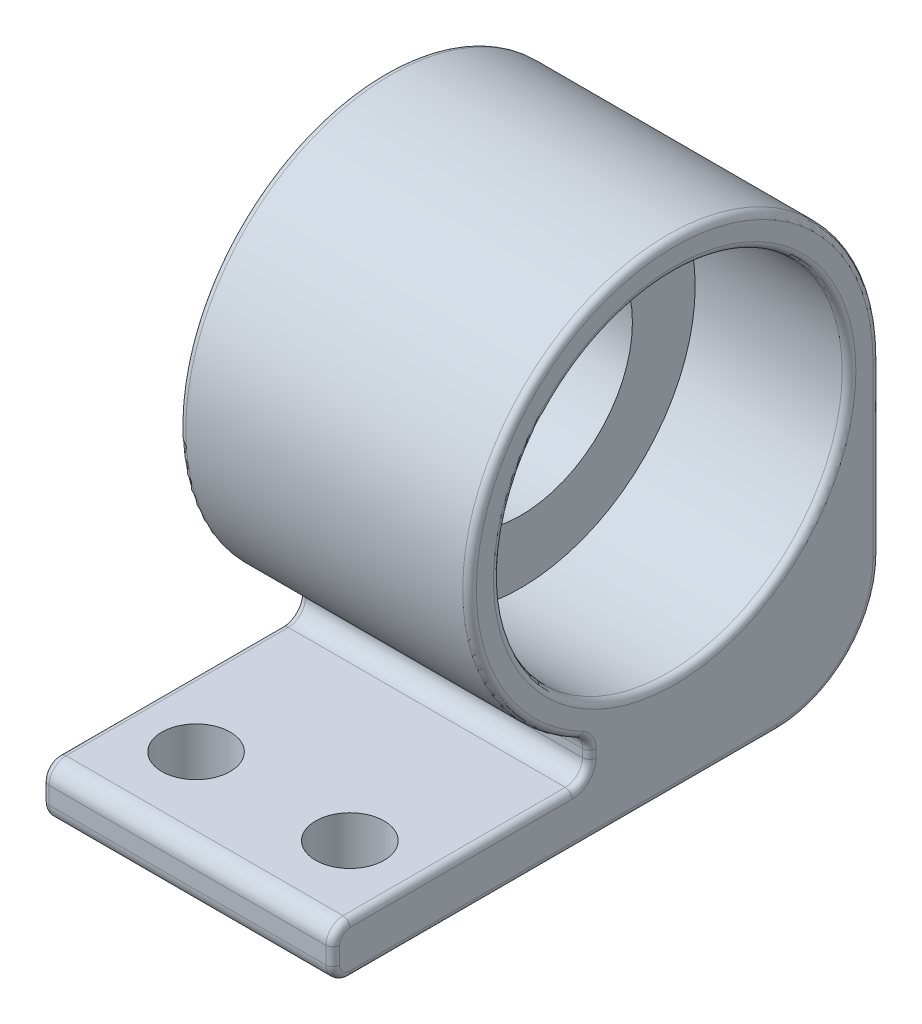
from build123d import *

# Parameters (mm, degrees)
EXTRUDE_1_DEPTH             = 8.5
SKETCH_2_R                  = 2
CUT_EXTRUDE_1_DEPTH         = 10
SKETCH_6_R                  = 5.1
CUT_EXTRUDE_3_DEPTH         = 4.5
HOLE_WIZARD_5_16_18_1_D     = 6.5278
HOLE_WIZARD_5_16_18_1_DEPTH = 3.2
HOLE_WIZARD_5_16_18_1_TIP   = 1.961148974
CUT_EXTRUDE_2_REACH         = 20.125
SKETCH_5_R                  = 1
FILLET_1_R                  = 0.2


with BuildPart() as part:
    # 草图1 → 凸台-拉伸1 (new body)
    with BuildSketch(Plane(origin=(0, 0, 0), x_dir=(0, 0, -1), z_dir=(1, 0, 0))):
        with BuildLine():
            Line((-9.5, -6.5), (-3, -6.5))
            ThreePointArc((-3, -6.5), (-2.646446609, -6.353553391), (-2.5, -6))
            Line((-2.5, -6), (-2.5, -5.766281297))
            ThreePointArc((-2.5, -5.766281297), (-2.572574793, -5.506844037), (-2.769230769, -5.322721198))
            ThreePointArc((-2.769230769, -5.322721198), (-3.11324713, 5.129102486), (6, 0))
            Line((6, 0), (6, -5))
            ThreePointArc((6, -5), (5.121320344, -7.121320344), (3, -8))
            Line((3, -8), (-9.5, -8))
            ThreePointArc((-9.5, -8), (-9.853553391, -7.853553391), (-10, -7.5))
            Line((-10, -7.5), (-10, -7))
            ThreePointArc((-10, -7), (-9.853553391, -6.646446609), (-9.5, -6.5))
        make_face()
    extrude(amount=EXTRUDE_1_DEPTH)

    # 草图2 → 切除-拉伸1 (cut)
    with BuildSketch(Plane.ZY):
        Circle(SKETCH_2_R)
    extrude(amount=-CUT_EXTRUDE_1_DEPTH, mode=Mode.SUBTRACT)

    # 草图6 → 切除-拉伸3 (cut)
    with BuildSketch(Plane(origin=(8.5, 0, 0), x_dir=(0, 0, -1), z_dir=(1, 0, 0))):
        Circle(SKETCH_6_R)
    extrude(amount=-CUT_EXTRUDE_3_DEPTH, mode=Mode.SUBTRACT)

    # 5/16-18 螺纹孔1
    with Locations(Plane(origin=(4, 0, 0), x_dir=(0, 0, -1), z_dir=(1, 0, 0))):
        with Locations((0, 0)):
            Hole(HOLE_WIZARD_5_16_18_1_D / 2, depth=HOLE_WIZARD_5_16_18_1_DEPTH)
            with Locations((0, 0, -(HOLE_WIZARD_5_16_18_1_DEPTH + HOLE_WIZARD_5_16_18_1_TIP / 2))):  # 118° drill point
                Cone(0, HOLE_WIZARD_5_16_18_1_D / 2, HOLE_WIZARD_5_16_18_1_TIP, mode=Mode.SUBTRACT)

    # 草图5 → 切除-拉伸2 (cut, up to next)
    with BuildSketch(Plane(origin=(0, -6.5, 0), x_dir=(1, 0, 0), z_dir=(0, 1, 0)), mode=Mode.PRIVATE) as cut_extrude_2_sk1:
        with Locations(Location((2, -7.5, 0), (0, 0, 270))):
            Circle(SKETCH_5_R)
    cut_extrude_2_tool1 = extrude(cut_extrude_2_sk1.sketch, amount=-CUT_EXTRUDE_2_REACH, mode=Mode.PRIVATE) & part.part
    # 草图5 → 切除-拉伸2 (cut, up to next)
    with BuildSketch(Plane(origin=(0, -6.5, 0), x_dir=(1, 0, 0), z_dir=(0, 1, 0)), mode=Mode.PRIVATE) as cut_extrude_2_sk2:
        with Locations(Location((6.5, -7.5, 0), (0, 0, 270))):
            Circle(SKETCH_5_R)
    cut_extrude_2_tool2 = extrude(cut_extrude_2_sk2.sketch, amount=-CUT_EXTRUDE_2_REACH, mode=Mode.PRIVATE) & part.part
    add(cut_extrude_2_tool1.solids().sort_by_distance((2, -6.5, 7.5))[0], mode=Mode.SUBTRACT)
    add(cut_extrude_2_tool2.solids().sort_by_distance((6.5, -6.5, 7.5))[0], mode=Mode.SUBTRACT)

    # 圆角1
    # the kernel refuses this fillet: 0.2 mm, written as the material it takes off along each edge
    with BuildSketch(Plane(origin=(8.5, -6, 2.5), x_dir=(0, 0, -1), z_dir=(0, 1, 0))) as fillet_1_piece_1:
        with BuildLine():
            CenterArc((FILLET_1_R, FILLET_1_R), FILLET_1_R, 180, 90)
            Line((0, FILLET_1_R), (-FILLET_1_R * 0.02, FILLET_1_R))
            Line((-FILLET_1_R * 0.02, FILLET_1_R), (-FILLET_1_R * 0.02, -FILLET_1_R * 0.02))
            Line((-FILLET_1_R * 0.02, -FILLET_1_R * 0.02), (FILLET_1_R, -FILLET_1_R * 0.02))
            Line((FILLET_1_R, -FILLET_1_R * 0.02), (FILLET_1_R, 0))
        make_face()
    extrude(amount=0.233718703, mode=Mode.SUBTRACT)
    with BuildSketch(Plane(origin=(0, 0, -6), x_dir=(0, 0, 1), z_dir=(0, -1, 0))) as fillet_1_piece_2:
        with BuildLine():
            CenterArc((FILLET_1_R, -FILLET_1_R), FILLET_1_R, 90, 90)
            Line((0, -FILLET_1_R), (-FILLET_1_R * 0.02, -FILLET_1_R))
            Line((-FILLET_1_R * 0.02, -FILLET_1_R), (-FILLET_1_R * 0.02, FILLET_1_R * 0.02))
            Line((-FILLET_1_R * 0.02, FILLET_1_R * 0.02), (FILLET_1_R, FILLET_1_R * 0.02))
            Line((FILLET_1_R, FILLET_1_R * 0.02), (FILLET_1_R, 0))
        make_face()
    extrude(amount=5, mode=Mode.SUBTRACT)
    with BuildSketch(Plane(origin=(0, -5, -3), x_dir=(0, 0, -1), z_dir=(0, 1, 0))) as fillet_1_piece_3:
        with BuildLine():
            CenterArc((3 - FILLET_1_R, -FILLET_1_R), FILLET_1_R, 0, 90)
            Line((3 - FILLET_1_R, 0), (3 - FILLET_1_R, FILLET_1_R * 0.02))
            Line((3 - FILLET_1_R, FILLET_1_R * 0.02), (3 + FILLET_1_R * 0.02, FILLET_1_R * 0.02))
            Line((3 + FILLET_1_R * 0.02, FILLET_1_R * 0.02), (3 + FILLET_1_R * 0.02, -FILLET_1_R))
            Line((3 + FILLET_1_R * 0.02, -FILLET_1_R), (3, -FILLET_1_R))
        make_face()
    revolve(axis=Axis((0, -5, -3), (-1, 0, 0)), revolution_arc=90, mode=Mode.SUBTRACT)
    with BuildSketch(Plane(origin=(0, -8, -3), x_dir=(1, 0, 0), z_dir=(0, 0, 1))) as fillet_1_piece_4:
        with BuildLine():
            CenterArc((FILLET_1_R, FILLET_1_R), FILLET_1_R, 180, 90)
            Line((0, FILLET_1_R), (-FILLET_1_R * 0.02, FILLET_1_R))
            Line((-FILLET_1_R * 0.02, FILLET_1_R), (-FILLET_1_R * 0.02, -FILLET_1_R * 0.02))
            Line((-FILLET_1_R * 0.02, -FILLET_1_R * 0.02), (FILLET_1_R, -FILLET_1_R * 0.02))
            Line((FILLET_1_R, -FILLET_1_R * 0.02), (FILLET_1_R, 0))
        make_face()
    extrude(amount=12.5, mode=Mode.SUBTRACT)
    with BuildSketch(Plane(origin=(0, -7.5, 9.5), x_dir=(0, -1, 0), z_dir=(0, 0, -1))) as fillet_1_piece_5:
        with BuildLine():
            CenterArc((0.5 - FILLET_1_R, -FILLET_1_R), FILLET_1_R, 0, 90)
            Line((0.5, -FILLET_1_R), (0.5 + FILLET_1_R * 0.02, -FILLET_1_R))
            Line((0.5 + FILLET_1_R * 0.02, -FILLET_1_R), (0.5 + FILLET_1_R * 0.02, FILLET_1_R * 0.02))
            Line((0.5 + FILLET_1_R * 0.02, FILLET_1_R * 0.02), (0.5 - FILLET_1_R, FILLET_1_R * 0.02))
            Line((0.5 - FILLET_1_R, FILLET_1_R * 0.02), (0.5 - FILLET_1_R, 0))
        make_face()
    revolve(axis=Axis((0, -7.5, 9.5), (-1, 0, 0)), revolution_arc=90, mode=Mode.SUBTRACT)
    with BuildSketch(Plane(origin=(0, -7.5, 10), x_dir=(0, 0, -1), z_dir=(0, 1, 0))) as fillet_1_piece_6:
        with BuildLine():
            CenterArc((FILLET_1_R, -FILLET_1_R), FILLET_1_R, 90, 90)
            Line((0, -FILLET_1_R), (-FILLET_1_R * 0.02, -FILLET_1_R))
            Line((-FILLET_1_R * 0.02, -FILLET_1_R), (-FILLET_1_R * 0.02, FILLET_1_R * 0.02))
            Line((-FILLET_1_R * 0.02, FILLET_1_R * 0.02), (FILLET_1_R, FILLET_1_R * 0.02))
            Line((FILLET_1_R, FILLET_1_R * 0.02), (FILLET_1_R, 0))
        make_face()
    extrude(amount=0.5, mode=Mode.SUBTRACT)
    with BuildSketch(Plane(origin=(0, -7, 9.5), x_dir=(0, 0, 1), z_dir=(0, -1, 0))) as fillet_1_piece_7:
        with BuildLine():
            CenterArc((0.5 - FILLET_1_R, -FILLET_1_R), FILLET_1_R, 0, 90)
            Line((0.5, -FILLET_1_R), (0.5 + FILLET_1_R * 0.02, -FILLET_1_R))
            Line((0.5 + FILLET_1_R * 0.02, -FILLET_1_R), (0.5 + FILLET_1_R * 0.02, FILLET_1_R * 0.02))
            Line((0.5 + FILLET_1_R * 0.02, FILLET_1_R * 0.02), (0.5 - FILLET_1_R, FILLET_1_R * 0.02))
            Line((0.5 - FILLET_1_R, FILLET_1_R * 0.02), (0.5 - FILLET_1_R, 0))
        make_face()
    revolve(axis=Axis((0, -7, 9.5), (-1, 0, 0)), revolution_arc=90, mode=Mode.SUBTRACT)
    with BuildSketch(Plane(origin=(0, -6.5, 9.5), x_dir=(0, -1, 0), z_dir=(0, 0, -1))) as fillet_1_piece_8:
        with BuildLine():
            CenterArc((FILLET_1_R, -FILLET_1_R), FILLET_1_R, 90, 90)
            Line((0, -FILLET_1_R), (-FILLET_1_R * 0.02, -FILLET_1_R))
            Line((-FILLET_1_R * 0.02, -FILLET_1_R), (-FILLET_1_R * 0.02, FILLET_1_R * 0.02))
            Line((-FILLET_1_R * 0.02, FILLET_1_R * 0.02), (FILLET_1_R, FILLET_1_R * 0.02))
            Line((FILLET_1_R, FILLET_1_R * 0.02), (FILLET_1_R, 0))
        make_face()
    extrude(amount=6.5, mode=Mode.SUBTRACT)
    with BuildSketch(Plane(origin=(0, -6, 3), x_dir=(0, -1, 0), z_dir=(0, 0, 1))) as fillet_1_piece_9:
        with BuildLine():
            CenterArc((0.5 + FILLET_1_R, FILLET_1_R), FILLET_1_R, 180, 90)
            Line((0.5, FILLET_1_R), (0.5 - FILLET_1_R * 0.02, FILLET_1_R))
            Line((0.5 - FILLET_1_R * 0.02, FILLET_1_R), (0.5 - FILLET_1_R * 0.02, -FILLET_1_R * 0.02))
            Line((0.5 - FILLET_1_R * 0.02, -FILLET_1_R * 0.02), (0.5 + FILLET_1_R, -FILLET_1_R * 0.02))
            Line((0.5 + FILLET_1_R, -FILLET_1_R * 0.02), (0.5 + FILLET_1_R, 0))
        make_face()
    revolve(axis=Axis((0, -6, 3), (1, 0, 0)), revolution_arc=90, mode=Mode.SUBTRACT)
    with BuildSketch(Plane(origin=(8.5, -6, 3), x_dir=(0, -1, 0), z_dir=(0, 0, 1))) as fillet_1_piece_10:
        with BuildLine():
            CenterArc((0.5 + FILLET_1_R, -FILLET_1_R), FILLET_1_R, 90, 90)
            Line((0.5, -FILLET_1_R), (0.5 - FILLET_1_R * 0.02, -FILLET_1_R))
            Line((0.5 - FILLET_1_R * 0.02, -FILLET_1_R), (0.5 - FILLET_1_R * 0.02, FILLET_1_R * 0.02))
            Line((0.5 - FILLET_1_R * 0.02, FILLET_1_R * 0.02), (0.5 + FILLET_1_R, FILLET_1_R * 0.02))
            Line((0.5 + FILLET_1_R, FILLET_1_R * 0.02), (0.5 + FILLET_1_R, 0))
        make_face()
    revolve(axis=Axis((8.5, -6, 3), (1, 0, 0)), revolution_arc=90, mode=Mode.SUBTRACT)
    with BuildSketch(Plane(origin=(0, -6, 2.5), x_dir=(0, 0, -1), z_dir=(0, 1, 0))) as fillet_1_piece_11:
        with BuildLine():
            CenterArc((FILLET_1_R, -FILLET_1_R), FILLET_1_R, 90, 90)
            Line((0, -FILLET_1_R), (-FILLET_1_R * 0.02, -FILLET_1_R))
            Line((-FILLET_1_R * 0.02, -FILLET_1_R), (-FILLET_1_R * 0.02, FILLET_1_R * 0.02))
            Line((-FILLET_1_R * 0.02, FILLET_1_R * 0.02), (FILLET_1_R, FILLET_1_R * 0.02))
            Line((FILLET_1_R, FILLET_1_R * 0.02), (FILLET_1_R, 0))
        make_face()
    extrude(amount=0.233718703, mode=Mode.SUBTRACT)
    with BuildSketch(Plane(origin=(0, -5.766281297, 3), x_dir=(0, 0, -1), z_dir=(0, -1, 0))) as fillet_1_piece_12:
        with BuildLine():
            CenterArc((0.5 + FILLET_1_R, FILLET_1_R), FILLET_1_R, 180, 90)
            Line((0.5, FILLET_1_R), (0.5 - FILLET_1_R * 0.02, FILLET_1_R))
            Line((0.5 - FILLET_1_R * 0.02, FILLET_1_R), (0.5 - FILLET_1_R * 0.02, -FILLET_1_R * 0.02))
            Line((0.5 - FILLET_1_R * 0.02, -FILLET_1_R * 0.02), (0.5 + FILLET_1_R, -FILLET_1_R * 0.02))
            Line((0.5 + FILLET_1_R, -FILLET_1_R * 0.02), (0.5 + FILLET_1_R, 0))
        make_face()
    revolve(axis=Axis((0, -5.766281297, 3), (1, 0, 0)), revolution_arc=62.51357375, mode=Mode.SUBTRACT)
    with BuildSketch(Plane(origin=(0, 0, 0), x_dir=(0, -0.8871201995900613, 0.46153846153846145), z_dir=(0, -0.46153846153846145, -0.8871201995900613))) as fillet_1_piece_13:
        with BuildLine():
            CenterArc((6 - FILLET_1_R, -FILLET_1_R), FILLET_1_R, 0, 90)
            Line((6, -FILLET_1_R), (6 + FILLET_1_R * 0.02, -FILLET_1_R))
            Line((6 + FILLET_1_R * 0.02, -FILLET_1_R), (6 + FILLET_1_R * 0.02, FILLET_1_R * 0.02))
            Line((6 + FILLET_1_R * 0.02, FILLET_1_R * 0.02), (6 - FILLET_1_R, FILLET_1_R * 0.02))
            Line((6 - FILLET_1_R, FILLET_1_R * 0.02), (6 - FILLET_1_R, 0))
        make_face()
    revolve(axis=Axis((0, 0, 0), (-1, 0, 0)), revolution_arc=242.51357375, mode=Mode.SUBTRACT)
    with BuildSketch(Plane(origin=(8.5, -6.5, 9.5), x_dir=(0, -1, 0), z_dir=(0, 0, -1))) as fillet_1_piece_14:
        with BuildLine():
            CenterArc((FILLET_1_R, FILLET_1_R), FILLET_1_R, 180, 90)
            Line((0, FILLET_1_R), (-FILLET_1_R * 0.02, FILLET_1_R))
            Line((-FILLET_1_R * 0.02, FILLET_1_R), (-FILLET_1_R * 0.02, -FILLET_1_R * 0.02))
            Line((-FILLET_1_R * 0.02, -FILLET_1_R * 0.02), (FILLET_1_R, -FILLET_1_R * 0.02))
            Line((FILLET_1_R, -FILLET_1_R * 0.02), (FILLET_1_R, 0))
        make_face()
    extrude(amount=6.5, mode=Mode.SUBTRACT)
    with BuildSketch(Plane(origin=(8.5, -7, 9.5), x_dir=(0, 0, 1), z_dir=(0, -1, 0))) as fillet_1_piece_15:
        with BuildLine():
            CenterArc((0.5 - FILLET_1_R, FILLET_1_R), FILLET_1_R, 270, 90)
            Line((0.5, FILLET_1_R), (0.5 + FILLET_1_R * 0.02, FILLET_1_R))
            Line((0.5 + FILLET_1_R * 0.02, FILLET_1_R), (0.5 + FILLET_1_R * 0.02, -FILLET_1_R * 0.02))
            Line((0.5 + FILLET_1_R * 0.02, -FILLET_1_R * 0.02), (0.5 - FILLET_1_R, -FILLET_1_R * 0.02))
            Line((0.5 - FILLET_1_R, -FILLET_1_R * 0.02), (0.5 - FILLET_1_R, 0))
        make_face()
    revolve(axis=Axis((8.5, -7, 9.5), (-1, 0, 0)), revolution_arc=90, mode=Mode.SUBTRACT)
    with BuildSketch(Plane(origin=(8.5, -7.5, 10), x_dir=(0, 0, -1), z_dir=(0, 1, 0))) as fillet_1_piece_16:
        with BuildLine():
            CenterArc((FILLET_1_R, FILLET_1_R), FILLET_1_R, 180, 90)
            Line((0, FILLET_1_R), (-FILLET_1_R * 0.02, FILLET_1_R))
            Line((-FILLET_1_R * 0.02, FILLET_1_R), (-FILLET_1_R * 0.02, -FILLET_1_R * 0.02))
            Line((-FILLET_1_R * 0.02, -FILLET_1_R * 0.02), (FILLET_1_R, -FILLET_1_R * 0.02))
            Line((FILLET_1_R, -FILLET_1_R * 0.02), (FILLET_1_R, 0))
        make_face()
    extrude(amount=0.5, mode=Mode.SUBTRACT)
    with BuildSketch(Plane(origin=(8.5, -7.5, 9.5), x_dir=(0, -1, 0), z_dir=(0, 0, -1))) as fillet_1_piece_17:
        with BuildLine():
            CenterArc((0.5 - FILLET_1_R, FILLET_1_R), FILLET_1_R, 270, 90)
            Line((0.5, FILLET_1_R), (0.5 + FILLET_1_R * 0.02, FILLET_1_R))
            Line((0.5 + FILLET_1_R * 0.02, FILLET_1_R), (0.5 + FILLET_1_R * 0.02, -FILLET_1_R * 0.02))
            Line((0.5 + FILLET_1_R * 0.02, -FILLET_1_R * 0.02), (0.5 - FILLET_1_R, -FILLET_1_R * 0.02))
            Line((0.5 - FILLET_1_R, -FILLET_1_R * 0.02), (0.5 - FILLET_1_R, 0))
        make_face()
    revolve(axis=Axis((8.5, -7.5, 9.5), (-1, 0, 0)), revolution_arc=90, mode=Mode.SUBTRACT)
    with BuildSketch(Plane(origin=(8.5, -8, -3), x_dir=(-1, 0, 0), z_dir=(0, 0, 1))) as fillet_1_piece_18:
        with BuildLine():
            CenterArc((FILLET_1_R, -FILLET_1_R), FILLET_1_R, 90, 90)
            Line((0, -FILLET_1_R), (-FILLET_1_R * 0.02, -FILLET_1_R))
            Line((-FILLET_1_R * 0.02, -FILLET_1_R), (-FILLET_1_R * 0.02, FILLET_1_R * 0.02))
            Line((-FILLET_1_R * 0.02, FILLET_1_R * 0.02), (FILLET_1_R, FILLET_1_R * 0.02))
            Line((FILLET_1_R, FILLET_1_R * 0.02), (FILLET_1_R, 0))
        make_face()
    extrude(amount=12.5, mode=Mode.SUBTRACT)
    with BuildSketch(Plane(origin=(8.5, -5, -3), x_dir=(0, 0, -1), z_dir=(0, 1, 0))) as fillet_1_piece_19:
        with BuildLine():
            CenterArc((3 - FILLET_1_R, FILLET_1_R), FILLET_1_R, 270, 90)
            Line((3 - FILLET_1_R, 0), (3 - FILLET_1_R, -FILLET_1_R * 0.02))
            Line((3 - FILLET_1_R, -FILLET_1_R * 0.02), (3 + FILLET_1_R * 0.02, -FILLET_1_R * 0.02))
            Line((3 + FILLET_1_R * 0.02, -FILLET_1_R * 0.02), (3 + FILLET_1_R * 0.02, FILLET_1_R))
            Line((3 + FILLET_1_R * 0.02, FILLET_1_R), (3, FILLET_1_R))
        make_face()
    revolve(axis=Axis((8.5, -5, -3), (-1, 0, 0)), revolution_arc=90, mode=Mode.SUBTRACT)
    with BuildSketch(Plane(origin=(0, 0, 0), x_dir=(0, 0, 1), z_dir=(0, -1, 0))) as fillet_1_piece_20:
        with BuildLine():
            CenterArc((2.120759252, -0.2), FILLET_1_R, 90, 37.142271212)
            Line((2, -0.040572264), (1.997584815, -0.037383709))
            ThreePointArc((1.997584815, -0.037383709), (1.996, -0.020286132), (1.996, 0))
            Line((1.996, 0), (2, 0.004))
            Line((2, 0.004), (2.120759252, 0.004))
            Line((2.120759252, 0.004), (2.120759252, 0))
        make_face()
    revolve(axis=Axis((0, 0, 0), (-1, 0, 0)), mode=Mode.SUBTRACT)
    with BuildSketch(Plane(origin=(8.5, 0, -6), x_dir=(0, 0, 1), z_dir=(0, -1, 0))) as fillet_1_piece_21:
        with BuildLine():
            CenterArc((FILLET_1_R, FILLET_1_R), FILLET_1_R, 180, 90)
            Line((0, FILLET_1_R), (-FILLET_1_R * 0.02, FILLET_1_R))
            Line((-FILLET_1_R * 0.02, FILLET_1_R), (-FILLET_1_R * 0.02, -FILLET_1_R * 0.02))
            Line((-FILLET_1_R * 0.02, -FILLET_1_R * 0.02), (FILLET_1_R, -FILLET_1_R * 0.02))
            Line((FILLET_1_R, -FILLET_1_R * 0.02), (FILLET_1_R, 0))
        make_face()
    extrude(amount=5, mode=Mode.SUBTRACT)
    with BuildSketch(Plane(origin=(8.5, 0, 0), x_dir=(0, 0, -1), z_dir=(0, -1, 0))) as fillet_1_piece_22:
        with BuildLine():
            CenterArc((5.1 + FILLET_1_R, -FILLET_1_R), FILLET_1_R, 90, 90)
            Line((5.1, -FILLET_1_R), (5.1 - FILLET_1_R * 0.02, -FILLET_1_R))
            Line((5.1 - FILLET_1_R * 0.02, -FILLET_1_R), (5.1 - FILLET_1_R * 0.02, FILLET_1_R * 0.02))
            Line((5.1 - FILLET_1_R * 0.02, FILLET_1_R * 0.02), (5.1 + FILLET_1_R, FILLET_1_R * 0.02))
            Line((5.1 + FILLET_1_R, FILLET_1_R * 0.02), (5.1 + FILLET_1_R, 0))
        make_face()
    revolve(axis=Axis((8.5, 0, 0), (1, 0, 0)), mode=Mode.SUBTRACT)
    with BuildSketch(Plane(origin=(8.5, 0, 0), x_dir=(0, -0.8871201995900613, 0.46153846153846145), z_dir=(0, -0.46153846153846145, -0.8871201995900613))) as fillet_1_piece_23:
        with BuildLine():
            CenterArc((6 - FILLET_1_R, FILLET_1_R), FILLET_1_R, 270, 90)
            Line((6, FILLET_1_R), (6 + FILLET_1_R * 0.02, FILLET_1_R))
            Line((6 + FILLET_1_R * 0.02, FILLET_1_R), (6 + FILLET_1_R * 0.02, -FILLET_1_R * 0.02))
            Line((6 + FILLET_1_R * 0.02, -FILLET_1_R * 0.02), (6 - FILLET_1_R, -FILLET_1_R * 0.02))
            Line((6 - FILLET_1_R, -FILLET_1_R * 0.02), (6 - FILLET_1_R, 0))
        make_face()
    revolve(axis=Axis((8.5, 0, 0), (-1, 0, 0)), revolution_arc=242.51357375, mode=Mode.SUBTRACT)
    with BuildSketch(Plane(origin=(8.5, -5.766281297, 3), x_dir=(0, 0, -1), z_dir=(0, -1, 0))) as fillet_1_piece_24:
        with BuildLine():
            CenterArc((0.5 + FILLET_1_R, -FILLET_1_R), FILLET_1_R, 90, 90)
            Line((0.5, -FILLET_1_R), (0.5 - FILLET_1_R * 0.02, -FILLET_1_R))
            Line((0.5 - FILLET_1_R * 0.02, -FILLET_1_R), (0.5 - FILLET_1_R * 0.02, FILLET_1_R * 0.02))
            Line((0.5 - FILLET_1_R * 0.02, FILLET_1_R * 0.02), (0.5 + FILLET_1_R, FILLET_1_R * 0.02))
            Line((0.5 + FILLET_1_R, FILLET_1_R * 0.02), (0.5 + FILLET_1_R, 0))
        make_face()
    revolve(axis=Axis((8.5, -5.766281297, 3), (1, 0, 0)), revolution_arc=62.51357375, mode=Mode.SUBTRACT)


solid = part.part
